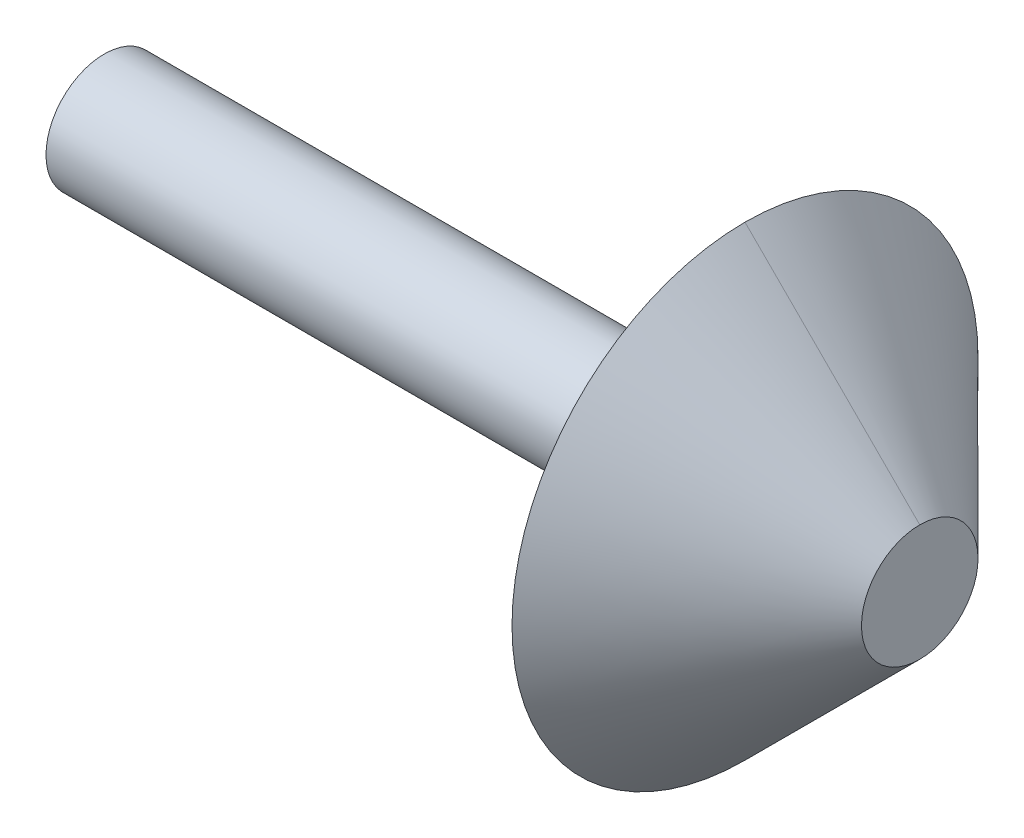
from build123d import *


with BuildPart() as part:
    # Sketch1 → Base-Revolve (revolve)
    with BuildSketch(Plane.XY):
        Polygon((0, 0), (0, 6.35), (69.85, 6.35), (69.85, 25.4), (88.9, 6.35), (88.9, 0), align=None)
    revolve(axis=Axis((0, 0, 0), (1, 0, 0)))


solid = part.part
